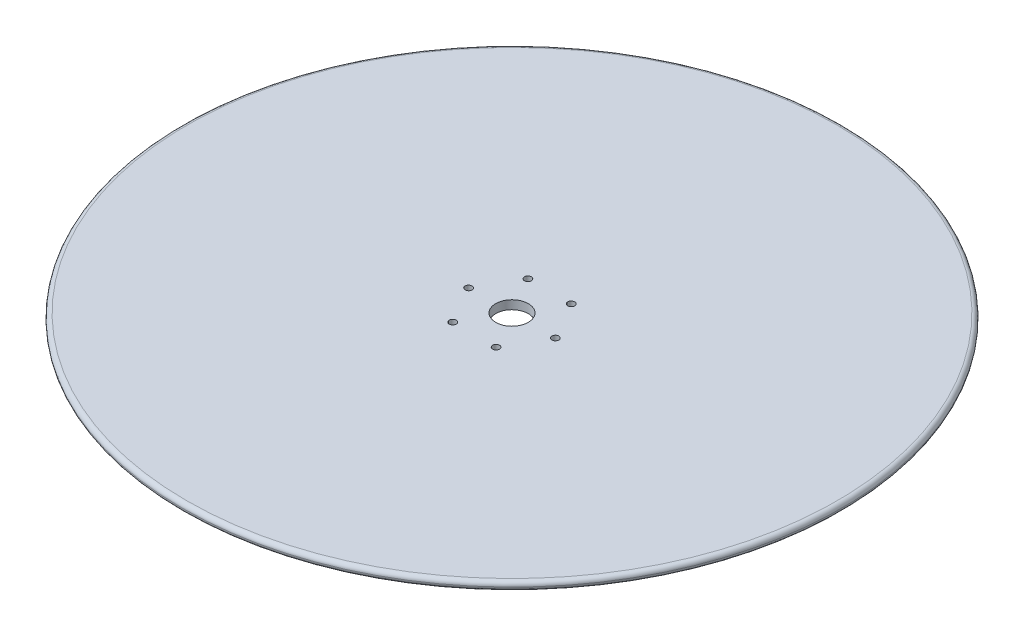
from build123d import *

# Parameters (mm, degrees)
CROQUIS1_R              = 380
CROQUIS1_R_2            = 18.75
SALIENTE_EXTRUIR1_DEPTH = 10
CROQUIS2_R              = 4
CORTAR_EXTRUIR1_DEPTH   = 538.494186015
REDONDEO1_R             = 5


with BuildPart() as part:
    # Croquis1 → Saliente-Extruir1 (new body)
    with BuildSketch(Plane(origin=(0, 0, 0), x_dir=(1, 0, 0), z_dir=(0, 1, 0))):
        with Locations(Location((0, 0, 0), (0, 0, 270))):
            Circle(CROQUIS1_R)
        with Locations(Location((0, 0, 0), (0, 0, 270))):
            Circle(CROQUIS1_R_2, mode=Mode.SUBTRACT)
    extrude(amount=SALIENTE_EXTRUIR1_DEPTH)

    # Croquis2 → Cortar-Extruir1 (cut, through all)
    with BuildSketch(Plane(origin=(0, 10, 0), x_dir=(1, 0, 0), z_dir=(0, 1, 0))):
        with Locations(Location((-25, -43.301270189, 0), (0, 0, 270))):
            Circle(CROQUIS2_R)
        with Locations(Location((-50, 0, 0), (0, 0, 270))):
            Circle(CROQUIS2_R)
        with Locations(Location((-25, 43.301270189, 0), (0, 0, 270))):
            Circle(CROQUIS2_R)
        with Locations(Location((25, 43.301270189, 0), (0, 0, 270))):
            Circle(CROQUIS2_R)
        with Locations(Location((50, 0, 0), (0, 0, 270))):
            Circle(CROQUIS2_R)
        with Locations(Location((25, -43.301270189, 0), (0, 0, 270))):
            Circle(CROQUIS2_R)
    extrude(amount=-CORTAR_EXTRUIR1_DEPTH, mode=Mode.SUBTRACT)

    # Redondeo1
    redondeo1_edges = [part.edges().sort_by_distance(p)[0] for p in [
        (0, 0, -380),
        (0, 10, -380),
    ]]
    fillet(redondeo1_edges, radius=REDONDEO1_R - 0.0001)  # a hair under: the kernel refuses the full size


solid = part.part
